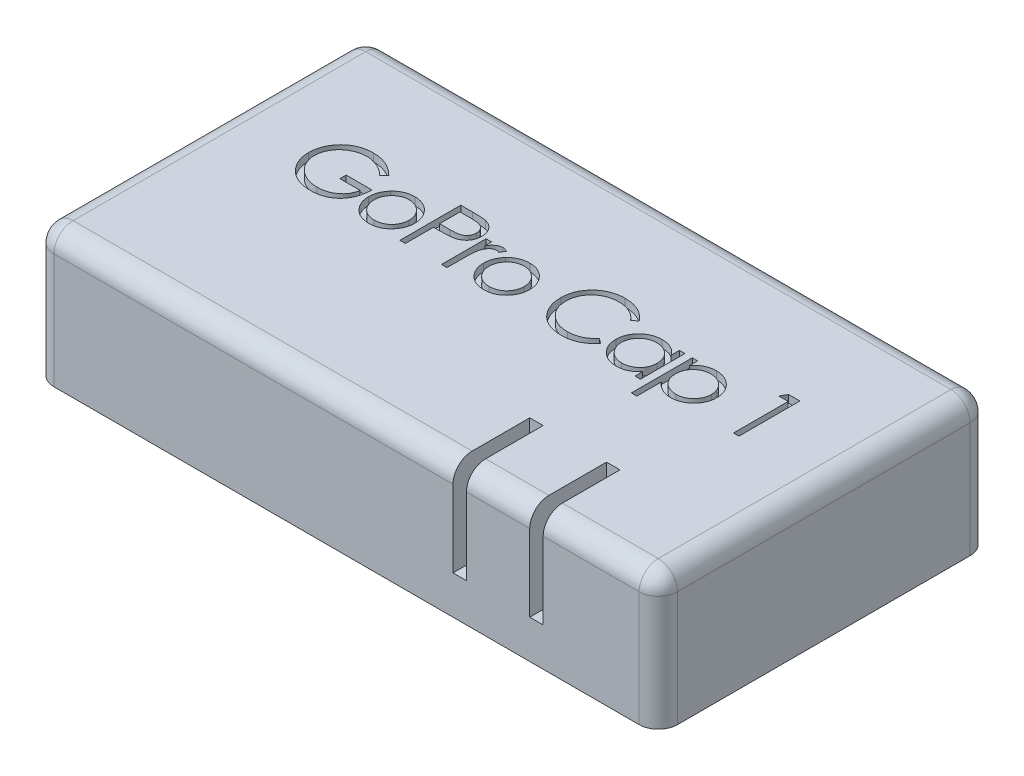
from build123d import *

# Parameters (mm, degrees)
SKETCH1_W           = 32.5
SKETCH1_H           = 17.25
BOSS_EXTRUDE1_DEPTH = 7
SKETCH2_W           = 28.5
SKETCH2_H           = 13.25
CUT_EXTRUDE1_DEPTH  = 5
FILLET1_R           = 1
FILLET2_R           = 1
SKETCH3_W           = 0.7
SKETCH3_H           = 2
CUT_EXTRUDE2_DEPTH  = 20.064446622
CUT_EXTRUDE3_DEPTH  = 0.4
SKETCH6_W           = 0.7
SKETCH6_H           = 4
CUT_EXTRUDE6_DEPTH  = 5


with BuildPart() as part:
    # Sketch1 → Boss-Extrude1 (new body)
    with BuildSketch(Plane(origin=(0, 0, 0), x_dir=(1, 0, 0), z_dir=(0, 1, 0))):
        Rectangle(SKETCH1_W, SKETCH1_H)
    extrude(amount=BOSS_EXTRUDE1_DEPTH)

    # Sketch2 → Cut-Extrude1 (cut)
    with BuildSketch(Plane.XZ):
        Rectangle(SKETCH2_W, SKETCH2_H)
    extrude(amount=-CUT_EXTRUDE1_DEPTH, mode=Mode.SUBTRACT)

    # Fillet1
    fillet1_edges = [part.edges().sort_by_distance(p)[0] for p in [
        (16.25, 7, 0),
        (0, 7, -8.625),
        (-16.25, 7, 0),
        (0, 7, 8.625),
    ]]
    fillet(fillet1_edges, radius=FILLET1_R)

    # Fillet2
    # the kernel refuses this fillet: 1 mm, written as the material it takes off along each edge
    with BuildSketch(Plane(origin=(-15.25, 6, 7.625), x_dir=(0, 0, 1), z_dir=(-1, 0, 0))) as fillet2_piece_1_section:
        Polygon((0, 0), (FILLET2_R, 0), (FILLET2_R, FILLET2_R), (0, FILLET2_R), align=None)
    fillet2_piece_1 = extrude(amount=FILLET2_R, mode=Mode.PRIVATE)
    fillet2_piece_1 = fillet2_piece_1 - Plane(origin=(-15.25, 6, 7.625), x_dir=(0, -0.7071067811865475, -0.7071067811865475), z_dir=(-1, 0, 0)) * Sphere(FILLET2_R, mode=Mode.PRIVATE)
    add(fillet2_piece_1, mode=Mode.SUBTRACT)
    with BuildSketch(Plane(origin=(-15.25, 6, -7.625), x_dir=(-1, 0, 0), z_dir=(0, 0, -1))) as fillet2_piece_2_section:
        Polygon((0, 0), (FILLET2_R, 0), (FILLET2_R, FILLET2_R), (0, FILLET2_R), align=None)
    fillet2_piece_2 = extrude(amount=FILLET2_R, mode=Mode.PRIVATE)
    fillet2_piece_2 = fillet2_piece_2 - Plane(origin=(-15.25, 6, -7.625), x_dir=(0.7071067811865475, -0.7071067811865475, 0), z_dir=(0, 0, -1)) * Sphere(FILLET2_R, mode=Mode.PRIVATE)
    add(fillet2_piece_2, mode=Mode.SUBTRACT)
    with BuildSketch(Plane(origin=(15.25, 6, 7.625), x_dir=(0, 0, 1), z_dir=(1, 0, 0))) as fillet2_piece_3_section:
        Polygon((0, 0), (FILLET2_R, 0), (FILLET2_R, -FILLET2_R), (0, -FILLET2_R), align=None)
    fillet2_piece_3 = extrude(amount=FILLET2_R, mode=Mode.PRIVATE)
    fillet2_piece_3 = fillet2_piece_3 - Plane(origin=(15.25, 6, 7.625), x_dir=(0, -0.7071067811865475, -0.7071067811865475), z_dir=(1, 0, 0)) * Sphere(FILLET2_R, mode=Mode.PRIVATE)
    add(fillet2_piece_3, mode=Mode.SUBTRACT)
    with BuildSketch(Plane(origin=(15.25, 6, -7.625), x_dir=(1, 0, 0), z_dir=(0, 0, -1))) as fillet2_piece_4_section:
        Polygon((0, 0), (FILLET2_R, 0), (FILLET2_R, -FILLET2_R), (0, -FILLET2_R), align=None)
    fillet2_piece_4 = extrude(amount=FILLET2_R, mode=Mode.PRIVATE)
    fillet2_piece_4 = fillet2_piece_4 - Plane(origin=(15.25, 6, -7.625), x_dir=(-0.7071067811865475, -0.7071067811865475, 0), z_dir=(0, 0, -1)) * Sphere(FILLET2_R, mode=Mode.PRIVATE)
    add(fillet2_piece_4, mode=Mode.SUBTRACT)
    with BuildSketch(Plane(origin=(16.25, -2.5, -8.625), x_dir=(-1, 0, 0), z_dir=(0, 1, 0)), Plane(origin=(16.25, -2.5, 8.625), x_dir=(0, 0, -1), z_dir=(0, 1, 0))) as fillet2_piece_5:
        with BuildLine():
            CenterArc((FILLET2_R, FILLET2_R), FILLET2_R, 180, 90)
            Line((0, FILLET2_R), (0, 0))
            Line((0, 0), (FILLET2_R, 0))
        make_face()
    extrude(amount=8.5, mode=Mode.SUBTRACT)
    with BuildSketch(Plane(origin=(-16.25, -2.5, -8.625), x_dir=(1, 0, 0), z_dir=(0, 1, 0)), Plane(origin=(-16.25, -2.5, 8.625), x_dir=(0, 0, -1), z_dir=(0, 1, 0))) as fillet2_piece_6:
        with BuildLine():
            CenterArc((FILLET2_R, -FILLET2_R), FILLET2_R, 90, 90)
            Line((0, -FILLET2_R), (0, 0))
            Line((0, 0), (FILLET2_R, 0))
        make_face()
    extrude(amount=8.5, mode=Mode.SUBTRACT)

    # Sketch3 → Cut-Extrude2 (cut, through all)
    with BuildSketch(Plane.XZ.offset(-5)):
        with Locations((9.9, 5.625)):
            Rectangle(SKETCH3_W, SKETCH3_H)
        with Locations((5.9, 5.625)):
            Rectangle(SKETCH3_W, SKETCH3_H)
    extrude(amount=-CUT_EXTRUDE2_DEPTH, mode=Mode.SUBTRACT)

    # Sketch4 → Cut-Extrude3 (cut)
    # profile 1 of 9: a face of its own
    with BuildSketch(Plane(origin=(0, 7, 0), x_dir=(1, 0, 0), z_dir=(0, 1, 0))):
        with BuildLine():
            Line((-9.051693105, 2.633112981), (-9.295923874, 2.401602564))
            add(Edge.make_bspline(
                [(-9.295923874, 2.401602564), (-9.340118865, 2.443177704), (-9.427454993, 2.525336601), (-9.569840356, 2.631935861), (-9.718397367, 2.723254395), (-9.872350846, 2.797555052), (-10.027888249, 2.856839342), (-10.182945067, 2.899047012), (-10.335930811, 2.925964242), (-10.437682502, 2.92918312), (-10.487820909, 2.930769231)],
                knots=[0, 0, 0, 0, 1.08915593, 2.152340314, 3.188132944, 4.216796309, 5.218260357, 6.173443236, 7.099959455, 8, 8, 8, 8], degree=3))
            add(Edge.make_bspline(
                [(-10.487820909, 2.930769231), (-10.518586387, 2.930394031), (-10.580037551, 2.929644605), (-10.671316029, 2.920079495), (-10.761637192, 2.906322797), (-10.850830539, 2.88641838), (-10.939069492, 2.86119159), (-11.026047159, 2.829636205), (-11.111925788, 2.792846805), (-11.195896447, 2.750335847), (-11.277303904, 2.703636272), (-11.354190462, 2.651885096), (-11.427046188, 2.596740979), (-11.494501716, 2.536823305), (-11.556945064, 2.47267482), (-11.615862516, 2.405488821), (-11.66918192, 2.33342973), (-11.717343191, 2.257823341), (-11.760306945, 2.179997569), (-11.798233366, 2.1007015), (-11.830071439, 2.020198146), (-11.855262302, 1.93838649), (-11.876045538, 1.855899455), (-11.890666511, 1.772165887), (-11.898909466, 1.687096129), (-11.900335295, 1.630130045), (-11.901052079, 1.601492388)],
                knots=[0, 0, 0, 0, 1.02818874, 2.053710826, 3.065248034, 4.081641283, 5.106893873, 6.131558223, 7.173050175, 8.228653731, 9.27666206, 10.308777013, 11.325269123, 12.329503258, 13.32196095, 14.316845687, 15.314881793, 16.315733098, 17.311955233, 18.285320748, 19.252783886, 20.203351036, 21.145449891, 22.095197417, 23.042428769, 24, 24, 24, 24], degree=3))
            add(Edge.make_bspline(
                [(-11.901052079, 1.601492388), (-11.900366535, 1.572218146), (-11.898997318, 1.513749602), (-11.890234028, 1.426487836), (-11.873970553, 1.340522078), (-11.852228417, 1.255569843), (-11.825031534, 1.17148564), (-11.791129187, 1.088634006), (-11.750973963, 1.007018008), (-11.704495091, 0.927373027), (-11.653526178, 0.849791427), (-11.596427812, 0.776712433), (-11.535775711, 0.707162899), (-11.469360245, 0.642687027), (-11.399311089, 0.581560207), (-11.323535381, 0.525466555), (-11.243523149, 0.473325596), (-11.159152321, 0.425794467), (-11.071338369, 0.383332438), (-10.981298314, 0.345573618), (-10.88874451, 0.314477362), (-10.794163356, 0.289133511), (-10.697667602, 0.26835967), (-10.598767438, 0.254995206), (-10.498190053, 0.245297095), (-10.430391436, 0.244588008), (-10.396234371, 0.244230769)],
                knots=[0, 0, 0, 0, 0.93586088, 1.869166235, 2.799637598, 3.729985548, 4.670839027, 5.622275134, 6.589130586, 7.576015415, 8.568469353, 9.55398029, 10.53834874, 11.515998671, 12.510579167, 13.508179873, 14.527009472, 15.561807829, 16.601455013, 17.643573243, 18.680854198, 19.719860599, 20.772568776, 21.833555941, 22.908541556, 24, 24, 24, 24], degree=3))
            add(Edge.make_bspline(
                [(-10.396234371, 0.244230769), (-10.355069727, 0.245091263), (-10.274236262, 0.246780984), (-10.155412846, 0.259934818), (-10.041291489, 0.280478695), (-9.932192861, 0.310564901), (-9.82799025, 0.348940378), (-9.728301653, 0.395200478), (-9.633911934, 0.451119539), (-9.544537341, 0.514232975), (-9.462207608, 0.584550002), (-9.387954224, 0.660427472), (-9.322961531, 0.741497075), (-9.266260839, 0.827281326), (-9.219353703, 0.918490281), (-9.180852024, 1.014676963), (-9.151339681, 1.115884634), (-9.139224811, 1.185817757), (-9.133103361, 1.221153846)],
                knots=[0, 0, 0, 0, 1.13008108, 2.219097802, 3.278683437, 4.311054135, 5.322181354, 6.324827112, 7.324222904, 8.330512327, 9.32562643, 10.293043162, 11.24128371, 12.174520618, 13.111833804, 14.052305215, 15.015860969, 16, 16, 16, 16], degree=3))
            Line((-9.133103361, 1.221153846), (-10.191436694, 1.221153846))
            Line((-10.191436694, 1.221153846), (-10.191436694, 1.546794872))
            Line((-10.191436694, 1.546794872), (-8.848167464, 1.546794872))
            add(Edge.make_bspline(
                [(-8.848167464, 1.546794872), (-8.849714912, 1.486100221), (-8.852743547, 1.367309826), (-8.873987849, 1.194072509), (-8.908292828, 1.030449616), (-8.955156111, 0.876268829), (-9.015821544, 0.731748642), (-9.089638052, 0.59674232), (-9.177787048, 0.472122045), (-9.277128662, 0.356870449), (-9.388616481, 0.254064664), (-9.509238015, 0.163707849), (-9.639192551, 0.087596191), (-9.778357162, 0.025674018), (-9.926276269, -0.022653106), (-10.083292157, -0.056917322), (-10.249191894, -0.077445931), (-10.362890166, -0.080068825), (-10.421039058, -0.081410256)],
                knots=[0, 0, 0, 0, 1.140356446, 2.231883559, 3.274166699, 4.278491846, 5.25512956, 6.21435461, 7.1637429, 8.11826594, 9.068280886, 10.0076534, 10.945064095, 11.891975133, 12.864533718, 13.863980011, 14.907571808, 16, 16, 16, 16], degree=3))
            add(Edge.make_bspline(
                [(-10.421039058, -0.081410256), (-10.456880395, -0.080893982), (-10.527571063, -0.079875723), (-10.631974977, -0.072639129), (-10.733500247, -0.061498892), (-10.832132084, -0.044675816), (-10.928233294, -0.02407038), (-11.021323917, 0.00231543), (-11.111758569, 0.03285775), (-11.199677028, 0.067597396), (-11.284281295, 0.107848828), (-11.365948207, 0.152579715), (-11.445129192, 0.201559407), (-11.521284892, 0.25563496), (-11.594812106, 0.314401906), (-11.66523673, 0.377978032), (-11.732953019, 0.446168976), (-11.775371439, 0.494591364), (-11.796745188, 0.518990385)],
                knots=[0, 0, 0, 0, 1.107784379, 2.184907829, 3.233506516, 4.263428166, 5.276301166, 6.270063455, 7.25232949, 8.225834625, 9.190232166, 10.146266622, 11.1027726, 12.066435141, 13.031522626, 14.010570082, 14.99756817, 16, 16, 16, 16], degree=3))
            add(Edge.make_bspline(
                [(-11.796745188, 0.518990385), (-11.827756712, 0.557698763), (-11.889265001, 0.634473), (-11.968438757, 0.757481521), (-12.035931458, 0.884846065), (-12.090693697, 1.016921192), (-12.133454675, 1.153583364), (-12.164121776, 1.29465795), (-12.182089817, 1.440326615), (-12.184678383, 1.538901533), (-12.185987976, 1.588772035)],
                knots=[0, 0, 0, 0, 1.023165419, 2.029347347, 3.013907458, 3.994755782, 4.975994455, 5.96558838, 6.970761222, 8, 8, 8, 8], degree=3))
            add(Edge.make_bspline(
                [(-12.185987976, 1.588772035), (-12.18550516, 1.626115707), (-12.184545665, 1.700328436), (-12.172911089, 1.810507565), (-12.156218374, 1.918730336), (-12.131682832, 2.024908283), (-12.100752649, 2.12911232), (-12.062150558, 2.23139083), (-12.01720626, 2.331804171), (-11.964967988, 2.42966118), (-11.906834228, 2.523663326), (-11.843742243, 2.61343219), (-11.77479612, 2.697332985), (-11.701121787, 2.776428266), (-11.621840232, 2.849724363), (-11.537694183, 2.917899877), (-11.448618794, 2.98104626), (-11.35433383, 3.038168896), (-11.256246574, 3.08948018), (-11.154592144, 3.134464679), (-11.049401572, 3.171642401), (-10.941462932, 3.203187187), (-10.829959199, 3.226514493), (-10.715699533, 3.243431569), (-10.59808836, 3.255007256), (-10.518589962, 3.255938217), (-10.478280645, 3.256410256)],
                knots=[0, 0, 0, 0, 1.008945113, 2.00506715, 2.99143336, 3.967273523, 4.948097931, 5.927297278, 6.919902385, 7.919676788, 8.923139349, 9.905703106, 10.883022732, 11.856032218, 12.825136022, 13.798837087, 14.781400844, 15.773989409, 16.776158564, 17.77167057, 18.775803737, 19.789618931, 20.80898985, 21.851988756, 22.910860228, 24, 24, 24, 24], degree=3))
            add(Edge.make_bspline(
                [(-10.478280645, 3.256410256), (-10.445407381, 3.255884575), (-10.380223562, 3.254842209), (-10.283226647, 3.247617136), (-10.187728984, 3.236165472), (-10.093588973, 3.220538316), (-10.001127198, 3.199253397), (-9.910080258, 3.173782381), (-9.820316172, 3.144126228), (-9.73211626, 3.108757774), (-9.644887475, 3.068613415), (-9.558144805, 3.023425524), (-9.472184632, 2.972421413), (-9.386857885, 2.915449634), (-9.301626499, 2.853488677), (-9.217838574, 2.784766415), (-9.133471617, 2.711992915), (-9.079222828, 2.659666934), (-9.051693105, 2.633112981)],
                knots=[0, 0, 0, 0, 0.985871117, 1.954866573, 2.915460327, 3.869826059, 4.81536089, 5.759505086, 6.70452669, 7.649098992, 8.607881297, 9.583363685, 10.581137262, 11.603961102, 12.659522466, 13.73993555, 14.853081303, 16, 16, 16, 16], degree=3))
        make_face()
    # profile 2 of 9: a face of its own
    with BuildSketch(Plane(origin=(0, 7, 0), x_dir=(1, 0, 0), z_dir=(0, 1, 0))):
        with BuildLine():
            add(Edge.make_bspline(
                [(-7.426286454, 2.360897436), (-7.382751514, 2.359970435), (-7.297390135, 2.358152812), (-7.172378696, 2.338726379), (-7.053048465, 2.309019841), (-6.938942419, 2.267952067), (-6.831521923, 2.212904869), (-6.729222294, 2.147219298), (-6.632324008, 2.069402231), (-6.574245974, 2.009205983), (-6.544766021, 1.978650841)],
                knots=[0, 0, 0, 0, 1.054011418, 2.066658804, 3.057071809, 4.030435133, 4.997543892, 5.974964718, 6.972108034, 8, 8, 8, 8], degree=3))
            add(Edge.make_bspline(
                [(-6.544766021, 1.978650841), (-6.519382392, 1.949428154), (-6.469106375, 1.89154832), (-6.404639616, 1.797699299), (-6.349102915, 1.700507922), (-6.3045958, 1.598683562), (-6.269502957, 1.49311511), (-6.244587647, 1.383439714), (-6.229767713, 1.269899585), (-6.227769308, 1.19278896), (-6.226757207, 1.153735978)],
                knots=[0, 0, 0, 0, 1.025258237, 2.030674902, 3.01204498, 3.988269485, 4.97094183, 5.956517959, 6.965070386, 8, 8, 8, 8], degree=3))
            add(Edge.make_bspline(
                [(-6.226757207, 1.153735978), (-6.22764742, 1.11445664), (-6.229406523, 1.036838836), (-6.246046804, 0.922521268), (-6.271928574, 0.811673108), (-6.308968885, 0.704758435), (-6.35646517, 0.601450442), (-6.41442315, 0.502200351), (-6.483249546, 0.406812344), (-6.561267457, 0.316096391), (-6.647493088, 0.232488468), (-6.741034165, 0.159619252), (-6.840052467, 0.097188297), (-6.945864652, 0.046899549), (-7.057504444, 0.007248606), (-7.175212641, -0.020600694), (-7.298806383, -0.037438793), (-7.383195363, -0.039601034), (-7.426286454, -0.040705128)],
                knots=[0, 0, 0, 0, 0.998656419, 1.973391657, 2.932242238, 3.890759089, 4.846373663, 5.82037756, 6.809684879, 7.83454468, 8.860553229, 9.859544525, 10.845671541, 11.83227036, 12.833544569, 13.85385346, 14.904124723, 16, 16, 16, 16], degree=3))
            add(Edge.make_bspline(
                [(-7.426286454, -0.040705128), (-7.469588664, -0.039597329), (-7.554398229, -0.037427648), (-7.678428227, -0.020666113), (-7.796347382, 0.007235772), (-7.908133325, 0.047029854), (-8.014400436, 0.097189905), (-8.113992472, 0.159430509), (-8.207609539, 0.232510078), (-8.29385341, 0.316090535), (-8.371866431, 0.406813853), (-8.440694088, 0.502199959), (-8.498651741, 0.601450544), (-8.546148112, 0.704758408), (-8.583188399, 0.811673115), (-8.609070176, 0.922521266), (-8.625710455, 1.036838836), (-8.627469558, 1.11445664), (-8.628359771, 1.153735978)],
                knots=[0, 0, 0, 0, 1.099876186, 2.154163076, 3.173186993, 4.173200201, 5.163417411, 6.152872554, 7.150605724, 8.17532212, 9.198891216, 10.186952605, 11.159729845, 12.11414092, 13.071450619, 14.029093627, 15.002601286, 16, 16, 16, 16], degree=3))
            add(Edge.make_bspline(
                [(-8.628359771, 1.153735978), (-8.627340768, 1.192576701), (-8.625323318, 1.269474659), (-8.610518284, 1.38280135), (-8.585700165, 1.492291124), (-8.550565256, 1.597452092), (-8.505647904, 1.698830237), (-8.450891593, 1.796261763), (-8.385767233, 1.88968641), (-8.335691177, 1.94749144), (-8.310350957, 1.976742788)],
                knots=[0, 0, 0, 0, 1.031353054, 2.041901799, 3.029428768, 4.008703097, 4.981709435, 5.96992636, 6.972712378, 8, 8, 8, 8], degree=3))
            add(Edge.make_bspline(
                [(-8.310350957, 1.976742788), (-8.28091545, 2.007562912), (-8.223025345, 2.068176108), (-8.125644713, 2.145766326), (-8.023596747, 2.212818764), (-7.914989135, 2.266772189), (-7.800976828, 2.309261415), (-7.681035087, 2.33880299), (-7.555599441, 2.358082819), (-7.469820356, 2.35994988), (-7.426286454, 2.360897436)],
                knots=[0, 0, 0, 0, 1.027980169, 2.021703884, 2.998553061, 3.971491411, 4.943284454, 5.930300938, 6.949603206, 8, 8, 8, 8], degree=3))
        make_face()
        with BuildLine():
            add(Edge.make_bspline(
                [(-7.427558489, 2.075961538), (-7.458344751, 2.075086516), (-7.519122532, 2.07335906), (-7.608584584, 2.060220089), (-7.694708866, 2.039403425), (-7.777658775, 2.009826888), (-7.857154581, 1.971637172), (-7.933272396, 1.924730303), (-8.00623611, 1.869727549), (-8.07461841, 1.806714983), (-8.13737665, 1.737881895), (-8.192238815, 1.664540884), (-8.238888733, 1.587881555), (-8.277750877, 1.507824192), (-8.306695255, 1.423557503), (-8.327716497, 1.336035787), (-8.340843072, 1.245080731), (-8.342554287, 1.18324895), (-8.343423874, 1.151827925)],
                knots=[0, 0, 0, 0, 1.021534396, 2.016698045, 2.994645724, 3.958388632, 4.93408049, 5.916473867, 6.921342795, 7.962252576, 8.998418191, 10.008913653, 10.997312074, 11.973003931, 12.956656626, 13.948281152, 14.957379055, 16, 16, 16, 16], degree=3))
            add(Edge.make_bspline(
                [(-8.343423874, 1.151827925), (-8.341966255, 1.111231443), (-8.339073155, 1.030655018), (-8.315546191, 0.911990642), (-8.276188637, 0.798069962), (-8.223041604, 0.689560812), (-8.156451677, 0.589165246), (-8.077995553, 0.499656113), (-7.988515253, 0.422380413), (-7.889077428, 0.358262789), (-7.781713154, 0.307317867), (-7.668087777, 0.271214511), (-7.549578004, 0.24774519), (-7.468587627, 0.245412495), (-7.427558489, 0.244230769)],
                knots=[0, 0, 0, 0, 1.016792936, 2.018143844, 3.017858371, 4.030088057, 5.03801393, 6.028138512, 7.003788237, 7.991172063, 8.984598303, 9.972568034, 10.972917682, 12, 12, 12, 12], degree=3))
            add(Edge.make_bspline(
                [(-7.427558489, 0.244230769), (-7.386531712, 0.245419381), (-7.305545993, 0.247765666), (-7.187200882, 0.27109631), (-7.073886065, 0.307476059), (-6.966633306, 0.358205493), (-6.867240744, 0.422623898), (-6.777116899, 0.499219754), (-6.699330659, 0.589402319), (-6.632806603, 0.689693792), (-6.5787892, 0.79790174), (-6.539615867, 0.912011668), (-6.516032343, 1.030649663), (-6.513146877, 1.111229649), (-6.511693105, 1.151827925)],
                knots=[0, 0, 0, 0, 1.02726834, 2.027799167, 3.010890988, 4.004497153, 4.992059811, 5.971914811, 6.958719428, 7.966827853, 8.981595046, 9.981490638, 10.983022906, 12, 12, 12, 12], degree=3))
            add(Edge.make_bspline(
                [(-6.511693105, 1.151827925), (-6.512562392, 1.183249138), (-6.514273018, 1.245081288), (-6.527403879, 1.336033657), (-6.548409261, 1.423565319), (-6.577412085, 1.507795351), (-6.616105369, 1.588088837), (-6.663654889, 1.664315804), (-6.718293033, 1.738135956), (-6.781808564, 1.806492473), (-6.850119486, 1.869752114), (-6.92311277, 1.924751631), (-6.999117715, 1.971431021), (-7.078382572, 2.01015354), (-7.161343116, 2.039134341), (-7.247346726, 2.060340285), (-7.336427075, 2.073303535), (-7.396987064, 2.075069871), (-7.427558489, 2.075961538)],
                knots=[0, 0, 0, 0, 1.042956736, 2.052379634, 3.044323526, 4.02829302, 5.004299113, 5.996692471, 7.007513377, 8.048758398, 9.090003419, 10.095195979, 11.07790575, 12.047570684, 13.018257071, 13.989683339, 14.985167495, 16, 16, 16, 16], degree=3))
        make_face(mode=Mode.SUBTRACT)
    # profile 3 of 9: a face of its own
    with BuildSketch(Plane(origin=(0, 7, 0), x_dir=(1, 0, 0), z_dir=(0, 1, 0))):
        with BuildLine():
            Line((-5.844129002, 3.175), (-5.221467744, 3.175))
            add(Edge.make_bspline(
                [(-5.221467744, 3.175), (-5.178640708, 3.174952923), (-5.096582204, 3.17486272), (-4.978912118, 3.172127915), (-4.872041862, 3.16847513), (-4.776201873, 3.163411556), (-4.69109727, 3.157427506), (-4.617113148, 3.149034585), (-4.553667979, 3.140271317), (-4.515652843, 3.131361898), (-4.498315701, 3.127298678)],
                knots=[0, 0, 0, 0, 1.415646017, 2.712440637, 3.8905458, 4.950247383, 5.884950622, 6.709939814, 7.411656543, 8, 8, 8, 8], degree=3))
            add(Edge.make_bspline(
                [(-4.498315701, 3.127298678), (-4.476368709, 3.121291623), (-4.43299188, 3.109419063), (-4.370488791, 3.085639471), (-4.311022088, 3.057443507), (-4.254387746, 3.025308933), (-4.201281714, 2.987857028), (-4.150911662, 2.946605961), (-4.103722109, 2.900603324), (-4.059978417, 2.850365081), (-4.01980578, 2.796734605), (-3.98521671, 2.738911296), (-3.956254154, 2.677868471), (-3.931413615, 2.613648589), (-3.913535231, 2.545712367), (-3.900066972, 2.474531849), (-3.891518396, 2.400114666), (-3.890699643, 2.349260357), (-3.890282848, 2.323372396)],
                knots=[0, 0, 0, 0, 0.999701418, 1.975846123, 2.934577507, 3.890451536, 4.834027766, 5.787354733, 6.749476667, 7.726910423, 8.712836071, 9.690891519, 10.682875813, 11.679750201, 12.712814741, 13.765529915, 14.8625177, 16, 16, 16, 16], degree=3))
            add(Edge.make_bspline(
                [(-3.890282848, 2.323372396), (-3.890665141, 2.297266841), (-3.891413122, 2.24618956), (-3.900390466, 2.171465674), (-3.912482854, 2.100056849), (-3.931076609, 2.032121418), (-3.95542947, 1.968062827), (-3.98399726, 1.906902138), (-4.018453749, 1.849679864), (-4.058045844, 1.796188264), (-4.102089076, 1.74637713), (-4.150397099, 1.700607423), (-4.202774885, 1.659147059), (-4.259055977, 1.62190309), (-4.319789054, 1.589739179), (-4.384053008, 1.560930767), (-4.452406418, 1.536736305), (-4.499707127, 1.524009035), (-4.523756406, 1.517538061)],
                knots=[0, 0, 0, 0, 1.121902311, 2.195077645, 3.232258892, 4.234102512, 5.217864754, 6.176164875, 7.132989551, 8.084763148, 9.034132444, 9.988522005, 10.94243251, 11.903244335, 12.886203696, 13.894208494, 14.929344452, 16, 16, 16, 16], degree=3))
            add(Edge.make_bspline(
                [(-4.523756406, 1.517538061), (-4.54364763, 1.513308071), (-4.587240405, 1.504037802), (-4.65903416, 1.493688702), (-4.742623189, 1.484855307), (-4.8378934, 1.478232132), (-4.944759278, 1.472562155), (-5.063278633, 1.468055384), (-5.193684117, 1.465579017), (-5.28464446, 1.465451298), (-5.332134811, 1.465384615)],
                knots=[0, 0, 0, 0, 0.601384939, 1.31797006, 2.144135048, 3.087295005, 4.142315834, 5.309527816, 6.595305764, 8, 8, 8, 8], degree=3))
            Line((-5.332134811, 1.465384615), (-5.559193105, 1.465384615))
            Line((-5.559193105, 1.465384615), (-5.559193105, 0))
            Line((-5.559193105, 0), (-5.844129002, 0))
            Line((-5.844129002, 0), (-5.844129002, 3.175))
        make_face()
        with BuildLine():
            Line((-5.559193105, 2.849358974), (-5.559193105, 1.791025641))
            Line((-5.559193105, 1.791025641), (-5.003313698, 1.784029447))
            add(Edge.make_bspline(
                [(-5.003313698, 1.784029447), (-4.976172051, 1.784015419), (-4.923775661, 1.783988339), (-4.848087087, 1.787603506), (-4.777865805, 1.791776847), (-4.713327511, 1.797887291), (-4.654443114, 1.806524432), (-4.601114427, 1.815243652), (-4.553754963, 1.827857802), (-4.498329258, 1.8448423), (-4.436567936, 1.873809745), (-4.369378089, 1.915855716), (-4.312436199, 1.969450359), (-4.263161745, 2.029709891), (-4.224058555, 2.096746959), (-4.195432762, 2.16847378), (-4.178613284, 2.244154758), (-4.176357951, 2.295941855), (-4.175218746, 2.322100361)],
                knots=[0, 0, 0, 0, 1.160613943, 2.240541288, 3.23993089, 4.169200891, 5.011653406, 5.7853311, 6.478053781, 7.106038997, 8.262395093, 9.384106736, 10.481365981, 11.59014053, 12.70357646, 13.786202915, 14.881775077, 16, 16, 16, 16], degree=3))
            add(Edge.make_bspline(
                [(-4.175218746, 2.322100361), (-4.176364146, 2.347626012), (-4.178641061, 2.398367848), (-4.195564594, 2.472734295), (-4.224002901, 2.543705256), (-4.26342424, 2.609902269), (-4.311267979, 2.669944969), (-4.36687524, 2.722103078), (-4.430115127, 2.764032765), (-4.488941737, 2.791095813), (-4.541194242, 2.80761967), (-4.586580377, 2.819181061), (-4.637825488, 2.82841179), (-4.69494626, 2.835886196), (-4.757499959, 2.842284693), (-4.826024002, 2.846626258), (-4.900258807, 2.849167579), (-4.95179411, 2.849293631), (-4.97850901, 2.849358974)],
                knots=[0, 0, 0, 0, 1.120700087, 2.227813068, 3.331159281, 4.466773991, 5.599788987, 6.693661531, 7.80175334, 8.91857717, 9.525282508, 10.207424825, 10.974604443, 11.810962634, 12.737642355, 13.736264703, 14.826523623, 16, 16, 16, 16], degree=3))
            Line((-4.97850901, 2.849358974), (-5.559193105, 2.849358974))
        make_face(mode=Mode.SUBTRACT)
    # profile 4 of 9: a face of its own
    with BuildSketch(Plane(origin=(0, 7, 0), x_dir=(1, 0, 0), z_dir=(0, 1, 0))):
        with BuildLine():
            Line((-3.670475156, 2.320192308), (-3.385539259, 2.320192308))
            Line((-3.385539259, 2.320192308), (-3.385539259, 1.978650841))
            add(Edge.make_bspline(
                [(-3.385539259, 1.978650841), (-3.364503742, 2.010451486), (-3.324273479, 2.071269971), (-3.257405322, 2.151705694), (-3.188913014, 2.218303629), (-3.118468666, 2.271374678), (-3.045554246, 2.311119436), (-2.971770012, 2.340232403), (-2.895955121, 2.357447539), (-2.845008233, 2.35974593), (-2.819483569, 2.360897436)],
                knots=[0, 0, 0, 0, 1.2804753, 2.448899062, 3.506932113, 4.484331642, 5.4025378, 6.288909075, 7.142734305, 8, 8, 8, 8], degree=3))
            add(Edge.make_bspline(
                [(-2.819483569, 2.360897436), (-2.799683973, 2.359817458), (-2.758945017, 2.357595334), (-2.697275097, 2.341982657), (-2.63373568, 2.317056165), (-2.592785085, 2.293615392), (-2.571436694, 2.281395232)],
                knots=[0, 0, 0, 0, 0.901110191, 1.854092781, 2.881294221, 4, 4, 4, 4], degree=3))
            Line((-2.571436694, 2.281395232), (-2.727897031, 2.034620393))
            add(Edge.make_bspline(
                [(-2.727897031, 2.034620393), (-2.741603072, 2.040734777), (-2.76761976, 2.052341049), (-2.805678546, 2.066077015), (-2.840768044, 2.074165024), (-2.863123272, 2.075390318), (-2.873545068, 2.075961538)],
                knots=[0, 0, 0, 0, 1.180555205, 2.24091978, 3.179933427, 4, 4, 4, 4], degree=3))
            add(Edge.make_bspline(
                [(-2.873545068, 2.075961538), (-2.896410269, 2.074437505), (-2.943048651, 2.071328917), (-3.011523876, 2.04689157), (-3.077969555, 2.007407959), (-3.130739563, 1.963619165), (-3.171599321, 1.921393663), (-3.200755097, 1.884519755), (-3.22750016, 1.843173425), (-3.253054574, 1.798061498), (-3.27633757, 1.748413709), (-3.298067877, 1.694726079), (-3.31771556, 1.636936427), (-3.328918996, 1.596675141), (-3.334657848, 1.576051683)],
                knots=[0, 0, 0, 0, 1.125678352, 2.296057538, 3.5422874, 4.923748041, 5.663163013, 6.437101912, 7.23742474, 8.08941207, 8.991984279, 9.93940061, 10.944477711, 12, 12, 12, 12], degree=3))
            add(Edge.make_bspline(
                [(-3.334657848, 1.576051683), (-3.338950805, 1.55765739), (-3.348459378, 1.516915428), (-3.357704559, 1.448563552), (-3.36683905, 1.367806376), (-3.373276697, 1.274419109), (-3.379243921, 1.168634964), (-3.382609496, 1.050292785), (-3.385424487, 0.919271102), (-3.385499841, 0.827672938), (-3.385539259, 0.779757612)],
                knots=[0, 0, 0, 0, 0.566838948, 1.255505196, 2.06880316, 3.007127437, 4.065329342, 5.249902469, 6.561414163, 8, 8, 8, 8], degree=3))
            Line((-3.385539259, 0.779757612), (-3.385539259, 0))
            Line((-3.385539259, 0), (-3.670475156, 0))
            Line((-3.670475156, 0), (-3.670475156, 2.320192308))
        make_face()
    # profile 5 of 9: a face of its own
    with BuildSketch(Plane(origin=(0, 7, 0), x_dir=(1, 0, 0), z_dir=(0, 1, 0))):
        with BuildLine():
            add(Edge.make_bspline(
                [(-1.434491582, 2.360897436), (-1.390956642, 2.359970435), (-1.305595263, 2.358152812), (-1.180583824, 2.338726379), (-1.061253593, 2.309019841), (-0.947147548, 2.267952067), (-0.839727051, 2.212904869), (-0.737427422, 2.147219298), (-0.640529136, 2.069402231), (-0.582451102, 2.009205983), (-0.55297115, 1.978650841)],
                knots=[0, 0, 0, 0, 1.054011418, 2.066658804, 3.057071809, 4.030435133, 4.997543892, 5.974964718, 6.972108034, 8, 8, 8, 8], degree=3))
            add(Edge.make_bspline(
                [(-0.55297115, 1.978650841), (-0.52758752, 1.949428154), (-0.477311503, 1.89154832), (-0.412844744, 1.797699299), (-0.357308043, 1.700507922), (-0.312800929, 1.598683562), (-0.277708086, 1.49311511), (-0.252792776, 1.383439714), (-0.237972842, 1.269899585), (-0.235974436, 1.19278896), (-0.234962335, 1.153735978)],
                knots=[0, 0, 0, 0, 1.025258237, 2.030674902, 3.01204498, 3.988269485, 4.97094183, 5.956517959, 6.965070386, 8, 8, 8, 8], degree=3))
            add(Edge.make_bspline(
                [(-0.234962335, 1.153735978), (-0.235852549, 1.11445664), (-0.237611651, 1.036838836), (-0.254251932, 0.922521268), (-0.280133703, 0.811673108), (-0.317174013, 0.704758435), (-0.364670298, 0.601450442), (-0.422628279, 0.502200351), (-0.491454674, 0.406812344), (-0.569472586, 0.316096391), (-0.655698216, 0.232488468), (-0.749239293, 0.159619252), (-0.848257595, 0.097188297), (-0.95406978, 0.046899549), (-1.065709572, 0.007248606), (-1.183417769, -0.020600694), (-1.307011512, -0.037438793), (-1.391400491, -0.039601034), (-1.434491582, -0.040705128)],
                knots=[0, 0, 0, 0, 0.998656419, 1.973391657, 2.932242238, 3.890759089, 4.846373663, 5.82037756, 6.809684879, 7.83454468, 8.860553229, 9.859544525, 10.845671541, 11.83227036, 12.833544569, 13.85385346, 14.904124723, 16, 16, 16, 16], degree=3))
            add(Edge.make_bspline(
                [(-1.434491582, -0.040705128), (-1.477793792, -0.039597329), (-1.562603358, -0.037427648), (-1.686633356, -0.020666113), (-1.80455251, 0.007235772), (-1.916338453, 0.047029854), (-2.022605564, 0.097189905), (-2.122197601, 0.159430509), (-2.215814667, 0.232510078), (-2.302058538, 0.316090535), (-2.380071559, 0.406813853), (-2.448899216, 0.502199959), (-2.506856869, 0.601450544), (-2.55435324, 0.704758408), (-2.591393528, 0.811673115), (-2.617275304, 0.922521266), (-2.633915583, 1.036838836), (-2.635674686, 1.11445664), (-2.6365649, 1.153735978)],
                knots=[0, 0, 0, 0, 1.099876186, 2.154163076, 3.173186993, 4.173200201, 5.163417411, 6.152872554, 7.150605724, 8.17532212, 9.198891216, 10.186952605, 11.159729845, 12.11414092, 13.071450619, 14.029093627, 15.002601286, 16, 16, 16, 16], degree=3))
            add(Edge.make_bspline(
                [(-2.6365649, 1.153735978), (-2.635545897, 1.192576701), (-2.633528446, 1.269474659), (-2.618723413, 1.38280135), (-2.593905293, 1.492291124), (-2.558770384, 1.597452092), (-2.513853032, 1.698830237), (-2.459096721, 1.796261763), (-2.393972361, 1.88968641), (-2.343896305, 1.94749144), (-2.318556085, 1.976742788)],
                knots=[0, 0, 0, 0, 1.031353054, 2.041901799, 3.029428768, 4.008703097, 4.981709435, 5.96992636, 6.972712378, 8, 8, 8, 8], degree=3))
            add(Edge.make_bspline(
                [(-2.318556085, 1.976742788), (-2.289120578, 2.007562912), (-2.231230473, 2.068176108), (-2.133849841, 2.145766326), (-2.031801875, 2.212818764), (-1.923194263, 2.266772189), (-1.809181956, 2.309261415), (-1.689240215, 2.33880299), (-1.563804569, 2.358082819), (-1.478025484, 2.35994988), (-1.434491582, 2.360897436)],
                knots=[0, 0, 0, 0, 1.027980169, 2.021703884, 2.998553061, 3.971491411, 4.943284454, 5.930300938, 6.949603206, 8, 8, 8, 8], degree=3))
        make_face()
        with BuildLine():
            add(Edge.make_bspline(
                [(-1.435763617, 2.075961538), (-1.466549879, 2.075086516), (-1.52732766, 2.07335906), (-1.616789712, 2.060220089), (-1.702913995, 2.039403425), (-1.785863903, 2.009826888), (-1.86535971, 1.971637172), (-1.941477525, 1.924730303), (-2.014441238, 1.869727549), (-2.082823538, 1.806714983), (-2.145581779, 1.737881895), (-2.200443943, 1.664540884), (-2.247093861, 1.587881555), (-2.285956005, 1.507824192), (-2.314900383, 1.423557503), (-2.335921625, 1.336035787), (-2.3490482, 1.245080731), (-2.350759415, 1.18324895), (-2.351629002, 1.151827925)],
                knots=[0, 0, 0, 0, 1.021534396, 2.016698045, 2.994645724, 3.958388632, 4.93408049, 5.916473867, 6.921342795, 7.962252576, 8.998418191, 10.008913653, 10.997312074, 11.973003931, 12.956656626, 13.948281152, 14.957379055, 16, 16, 16, 16], degree=3))
            add(Edge.make_bspline(
                [(-2.351629002, 1.151827925), (-2.350171384, 1.111231443), (-2.347278283, 1.030655018), (-2.323751319, 0.911990642), (-2.284393765, 0.798069962), (-2.231246733, 0.689560812), (-2.164656806, 0.589165246), (-2.086200681, 0.499656113), (-1.996720381, 0.422380413), (-1.897282556, 0.358262789), (-1.789918282, 0.307317867), (-1.676292905, 0.271214511), (-1.557783132, 0.24774519), (-1.476792755, 0.245412495), (-1.435763617, 0.244230769)],
                knots=[0, 0, 0, 0, 1.016792936, 2.018143844, 3.017858371, 4.030088057, 5.03801393, 6.028138512, 7.003788237, 7.991172063, 8.984598303, 9.972568034, 10.972917682, 12, 12, 12, 12], degree=3))
            add(Edge.make_bspline(
                [(-1.435763617, 0.244230769), (-1.39473684, 0.245419381), (-1.313751121, 0.247765666), (-1.19540601, 0.27109631), (-1.082091193, 0.307476059), (-0.974838434, 0.358205493), (-0.875445873, 0.422623898), (-0.785322027, 0.499219754), (-0.707535787, 0.589402319), (-0.641011731, 0.689693792), (-0.586994329, 0.79790174), (-0.547820996, 0.912011668), (-0.524237471, 1.030649663), (-0.521352005, 1.111229649), (-0.519898233, 1.151827925)],
                knots=[0, 0, 0, 0, 1.02726834, 2.027799167, 3.010890988, 4.004497153, 4.992059811, 5.971914811, 6.958719428, 7.966827853, 8.981595046, 9.981490638, 10.983022906, 12, 12, 12, 12], degree=3))
            add(Edge.make_bspline(
                [(-0.519898233, 1.151827925), (-0.520767521, 1.183249138), (-0.522478146, 1.245081288), (-0.535609007, 1.336033657), (-0.556614389, 1.423565319), (-0.585617214, 1.507795351), (-0.624310498, 1.588088837), (-0.671860017, 1.664315804), (-0.726498161, 1.738135956), (-0.790013693, 1.806492473), (-0.858324614, 1.869752114), (-0.931317899, 1.924751631), (-1.007322843, 1.971431021), (-1.086587701, 2.01015354), (-1.169548244, 2.039134341), (-1.255551854, 2.060340285), (-1.344632203, 2.073303535), (-1.405192192, 2.075069871), (-1.435763617, 2.075961538)],
                knots=[0, 0, 0, 0, 1.042956736, 2.052379634, 3.044323526, 4.02829302, 5.004299113, 5.996692471, 7.007513377, 8.048758398, 9.090003419, 10.095195979, 11.07790575, 12.047570684, 13.018257071, 13.989683339, 14.985167495, 16, 16, 16, 16], degree=3))
        make_face(mode=Mode.SUBTRACT)
    # profile 6 of 9: a face of its own
    with BuildSketch(Plane(origin=(0, 7, 0), x_dir=(1, 0, 0), z_dir=(0, 1, 0))):
        with BuildLine():
            Line((4.0309351, 2.592407853), (3.78161619, 2.401602564))
            add(Edge.make_bspline(
                [(3.78161619, 2.401602564), (3.763830849, 2.422798837), (3.72849995, 2.46490561), (3.671659102, 2.524032768), (3.612421184, 2.579427684), (3.550808838, 2.631354246), (3.485713065, 2.677996598), (3.418710769, 2.721785384), (3.348681114, 2.761035404), (3.25184204, 2.808626827), (3.125161492, 2.85828941), (2.96569046, 2.899930199), (2.799219678, 2.92643798), (2.685647569, 2.929308943), (2.627880213, 2.930769231)],
                knots=[0, 0, 0, 0, 0.757959112, 1.505699292, 2.245454638, 2.979532153, 3.711538275, 4.438200793, 5.171680507, 5.909471876, 7.393775596, 8.890124382, 10.418191784, 12, 12, 12, 12], degree=3))
            add(Edge.make_bspline(
                [(2.627880213, 2.930769231), (2.596054648, 2.930402779), (2.532698891, 2.929673277), (2.438674918, 2.920049285), (2.34640665, 2.906522687), (2.255954106, 2.886451858), (2.167432422, 2.861076696), (2.080262886, 2.830755071), (1.995707556, 2.793240323), (1.912596726, 2.751776402), (1.832968442, 2.704942934), (1.757625648, 2.653858679), (1.686843135, 2.599095284), (1.620564908, 2.540447495), (1.558723212, 2.478179431), (1.501766151, 2.411627492), (1.449890815, 2.341004449), (1.402068942, 2.267241573), (1.359240248, 2.190553719), (1.323381001, 2.110657048), (1.291626354, 2.028919754), (1.266499184, 1.944418344), (1.246610515, 1.857747406), (1.232887563, 1.768674334), (1.223373022, 1.677385211), (1.222647147, 1.61550962), (1.222281254, 1.584319912)],
                knots=[0, 0, 0, 0, 1.054917814, 2.100044995, 3.131103042, 4.146048494, 5.169673617, 6.183595914, 7.203665975, 8.234915748, 9.262203917, 10.264457458, 11.251630812, 12.227803204, 13.197192746, 14.159520551, 15.12972552, 16.100847026, 17.073214652, 18.039054194, 19.002613845, 19.979014051, 20.95965708, 21.949030935, 22.966165397, 24, 24, 24, 24], degree=3))
            add(Edge.make_bspline(
                [(1.222281254, 1.584319912), (1.223425904, 1.537392215), (1.225673273, 1.445255905), (1.245674262, 1.310299709), (1.276068166, 1.181013097), (1.321620868, 1.058204241), (1.377790292, 0.940358801), (1.448765704, 0.829470699), (1.530967849, 0.723864244), (1.625559644, 0.626035284), (1.729342063, 0.536669262), (1.840691954, 0.457974091), (1.959331986, 0.392374162), (2.083952215, 0.337785982), (2.215511618, 0.295824522), (2.353773618, 0.26628421), (2.498437499, 0.247014518), (2.597288312, 0.245169672), (2.647596759, 0.244230769)],
                knots=[0, 0, 0, 0, 1.029171465, 2.020641659, 2.987623507, 3.938342917, 4.889210282, 5.84687017, 6.821220943, 7.821438502, 8.827599549, 9.822697543, 10.807740252, 11.797342354, 12.80366471, 13.83203677, 14.896651826, 16, 16, 16, 16], degree=3))
            add(Edge.make_bspline(
                [(2.647596759, 0.244230769), (2.703025627, 0.245762734), (2.812122899, 0.248778006), (2.972113894, 0.274322468), (3.125272053, 0.315740722), (3.271605613, 0.373705266), (3.410702043, 0.449057348), (3.542779013, 0.540404709), (3.667948009, 0.648616268), (3.743214815, 0.731241677), (3.78161619, 0.773397436)],
                knots=[0, 0, 0, 0, 1.028121516, 2.023589091, 2.998037872, 3.967518031, 4.937445131, 5.927275754, 6.942489185, 8, 8, 8, 8], degree=3))
            Line((3.78161619, 0.773397436), (4.0309351, 0.5845002))
            add(Edge.make_bspline(
                [(4.0309351, 0.5845002), (4.010870815, 0.558611748), (3.970838351, 0.506958846), (3.906015721, 0.434140938), (3.837728459, 0.365647992), (3.76546935, 0.302032221), (3.690069639, 0.24202067), (3.61017547, 0.187318294), (3.526837134, 0.137161564), (3.440336999, 0.091235711), (3.350766972, 0.050489351), (3.258234377, 0.01560629), (3.16313807, -0.014442717), (3.065473701, -0.039164117), (2.965038693, -0.058460028), (2.862195478, -0.071359305), (2.756722091, -0.080196613), (2.685564516, -0.081002079), (2.649504812, -0.081410256)],
                knots=[0, 0, 0, 0, 0.986787822, 1.968848986, 2.935600012, 3.899624008, 4.868462664, 5.837806735, 6.815139263, 7.798259679, 8.787526145, 9.778297419, 10.776456485, 11.791383307, 12.812564526, 13.85620153, 14.913611965, 16, 16, 16, 16], degree=3))
            add(Edge.make_bspline(
                [(2.649504812, -0.081410256), (2.615356628, -0.081172592), (2.547832824, -0.080702639), (2.448138956, -0.073089745), (2.351084122, -0.062703197), (2.256945712, -0.047063936), (2.165210006, -0.028608713), (2.076708618, -0.003869787), (1.990570677, 0.023842671), (1.907142254, 0.056413623), (1.826352384, 0.093167589), (1.74846164, 0.134707074), (1.673505848, 0.180682766), (1.600748074, 0.23008124), (1.531263123, 0.284489221), (1.464448853, 0.343151096), (1.399930607, 0.405869149), (1.360013886, 0.451094623), (1.339944516, 0.473833133)],
                knots=[0, 0, 0, 0, 1.114604814, 2.203992996, 3.262667896, 4.300477797, 5.318619304, 6.316056647, 7.298880507, 8.271930387, 9.238335007, 10.195173496, 11.151986948, 12.108099108, 13.064862484, 14.031167946, 15.010108607, 16, 16, 16, 16], degree=3))
            add(Edge.make_bspline(
                [(1.339944516, 0.473833133), (1.307799325, 0.513331212), (1.243897028, 0.591850513), (1.162140158, 0.719109939), (1.092156304, 0.851977528), (1.035572433, 0.991151321), (0.991337668, 1.136319022), (0.960693298, 1.28755381), (0.940780057, 1.444714444), (0.938502866, 1.551609245), (0.937345357, 1.605944511)],
                knots=[0, 0, 0, 0, 0.994628077, 1.977248131, 2.950237994, 3.925870899, 4.908910175, 5.911660606, 6.938484602, 8, 8, 8, 8], degree=3))
            add(Edge.make_bspline(
                [(0.937345357, 1.605944511), (0.93875614, 1.663054101), (0.941531767, 1.775413654), (0.965113667, 1.940308598), (1.003049289, 2.098288795), (1.056930752, 2.249059335), (1.125243464, 2.393413232), (1.209631892, 2.530247753), (1.309115657, 2.660437993), (1.422914522, 2.782008518), (1.547707747, 2.893169216), (1.681346957, 2.990964844), (1.82357058, 3.072351447), (1.972811774, 3.14038368), (2.130188071, 3.192675443), (2.295363699, 3.229281549), (2.468028286, 3.252066361), (2.585832058, 3.254946728), (2.645688706, 3.256410256)],
                knots=[0, 0, 0, 0, 1.032925535, 2.032216505, 3.007276963, 3.968222605, 4.92396291, 5.891752235, 6.871517503, 7.883894988, 8.900124299, 9.891468569, 10.874487609, 11.85992873, 12.854644235, 13.869047385, 14.917252991, 16, 16, 16, 16], degree=3))
            add(Edge.make_bspline(
                [(2.645688706, 3.256410256), (2.682168977, 3.255972888), (2.754378, 3.255107162), (2.861196477, 3.246665162), (2.965193445, 3.232592104), (3.06644055, 3.213436813), (3.165430352, 3.189663028), (3.261406285, 3.1586929), (3.354931522, 3.12328119), (3.445416218, 3.082497439), (3.532426231, 3.036716895), (3.615934463, 2.986447007), (3.695277585, 2.931750098), (3.771013897, 2.87309136), (3.84187646, 2.80922981), (3.90987723, 2.741921991), (3.972706922, 2.669229165), (4.011490178, 2.618061832), (4.0309351, 2.592407853)],
                knots=[0, 0, 0, 0, 1.096760587, 2.17092713, 3.219439832, 4.250915756, 5.268269357, 6.278326846, 7.281116186, 8.274029601, 9.260640565, 10.235837813, 11.203064059, 12.156899882, 13.114053108, 14.069676657, 15.032185724, 16, 16, 16, 16], degree=3))
        make_face()
    # profile 7 of 9: a face of its own
    with BuildSketch(Plane(origin=(0, 7, 0), x_dir=(1, 0, 0), z_dir=(0, 1, 0))):
        with BuildLine():
            Line((6.693050485, 2.320192308), (6.693050485, 0))
            Line((6.693050485, 0), (6.408114588, 0))
            Line((6.408114588, 0), (6.408114588, 0.401327123))
            add(Edge.make_bspline(
                [(6.408114588, 0.401327123), (6.375984685, 0.365005492), (6.313282775, 0.294123371), (6.20856119, 0.201520257), (6.097555771, 0.124977066), (5.980805287, 0.063155356), (5.858415166, 0.016716848), (5.730656716, -0.016290596), (5.59747782, -0.037512147), (5.506534612, -0.039631252), (5.460448322, -0.040705128)],
                knots=[0, 0, 0, 0, 1.074387032, 2.096679803, 3.090159297, 4.057316773, 5.018401886, 5.985159533, 6.978961417, 8, 8, 8, 8], degree=3))
            add(Edge.make_bspline(
                [(5.460448322, -0.040705128), (5.419474535, -0.039592633), (5.338672413, -0.037398744), (5.219810322, -0.020378655), (5.105426639, 0.006954124), (4.995413276, 0.044964216), (4.890482116, 0.095383962), (4.789734742, 0.155746379), (4.693693086, 0.227629132), (4.603821047, 0.309805415), (4.52106059, 0.399063725), (4.448433578, 0.494264328), (4.387878998, 0.594995561), (4.337242211, 0.699982065), (4.298238384, 0.810032028), (4.271048016, 0.924764887), (4.254047754, 1.044044987), (4.251854771, 1.125270126), (4.250742793, 1.16645633)],
                knots=[0, 0, 0, 0, 1.033919861, 2.038935746, 3.024066025, 3.998881131, 4.97069526, 5.957263378, 6.95902576, 7.993208707, 9.027059324, 10.027763471, 11.009749337, 11.988697705, 12.965288445, 13.950418724, 14.960734635, 16, 16, 16, 16], degree=3))
            add(Edge.make_bspline(
                [(4.250742793, 1.16645633), (4.251879417, 1.206791261), (4.254126461, 1.286531244), (4.270866168, 1.403805492), (4.299015726, 1.516761342), (4.338519845, 1.625035141), (4.389176475, 1.728757901), (4.450796954, 1.82800298), (4.523385732, 1.923043791), (4.607071844, 2.011645547), (4.697726957, 2.093488533), (4.794708448, 2.164616738), (4.895603853, 2.226045594), (5.001978156, 2.274716962), (5.112256887, 2.314095221), (5.227421798, 2.341339413), (5.34699373, 2.357393412), (5.428174391, 2.359718205), (5.469352568, 2.360897436)],
                knots=[0, 0, 0, 0, 1.020392517, 2.01726096, 2.990465484, 3.961182959, 4.928053699, 5.906110375, 6.912531644, 7.948652711, 8.985773172, 9.998621852, 10.987621588, 11.969261332, 12.953316658, 13.946091881, 14.958173133, 16, 16, 16, 16], degree=3))
            add(Edge.make_bspline(
                [(5.469352568, 2.360897436), (5.516705298, 2.35959319), (5.609561765, 2.357035625), (5.745386459, 2.335751579), (5.873878235, 2.299793827), (5.996028969, 2.250882954), (6.11140002, 2.185887321), (6.218899156, 2.103899785), (6.319651416, 2.005437423), (6.378053537, 1.929808519), (6.408114588, 1.890880409)],
                knots=[0, 0, 0, 0, 1.038897134, 2.037228247, 3.008116434, 3.962042015, 4.918381754, 5.904844433, 6.921570401, 8, 8, 8, 8], degree=3))
            Line((6.408114588, 1.890880409), (6.408114588, 2.320192308))
            Line((6.408114588, 2.320192308), (6.693050485, 2.320192308))
        make_face()
        with BuildLine():
            add(Edge.make_bspline(
                [(5.473168674, 2.075961538), (5.431517811, 2.074479596), (5.349305631, 2.071554476), (5.228615714, 2.04871852), (5.11312426, 2.010723209), (5.003408893, 1.958760342), (4.901202725, 1.893419988), (4.809859181, 1.814388447), (4.728631159, 1.723822013), (4.660315805, 1.622129384), (4.604625854, 1.513110687), (4.565467189, 1.399151376), (4.539641515, 1.28230686), (4.537003071, 1.203056424), (4.53567869, 1.163276242)],
                knots=[0, 0, 0, 0, 1.031046209, 2.035121221, 3.029706178, 4.034933723, 5.034054252, 6.02443088, 7.017295772, 8.038157696, 9.050218397, 10.03989886, 11.016116709, 12, 12, 12, 12], degree=3))
            add(Edge.make_bspline(
                [(4.53567869, 1.163276242), (4.537370415, 1.123733788), (4.540747233, 1.044803872), (4.565013935, 0.927800063), (4.605726391, 0.813813896), (4.661281691, 0.703812852), (4.730847415, 0.60168299), (4.811482121, 0.509390164), (4.90396559, 0.430024609), (5.006406972, 0.363587667), (5.115815631, 0.309918809), (5.230872126, 0.272575693), (5.349413597, 0.248465849), (5.430015357, 0.245649645), (5.470624604, 0.244230769)],
                knots=[0, 0, 0, 0, 0.979072187, 1.954306742, 2.945804271, 3.96968567, 4.997920485, 5.998718438, 6.996577872, 8.005894225, 9.015743152, 10.005417472, 10.995077863, 12, 12, 12, 12], degree=3))
            add(Edge.make_bspline(
                [(5.470624604, 0.244230769), (5.511851074, 0.245736594), (5.593846435, 0.248731529), (5.714894405, 0.271665248), (5.832364836, 0.309555515), (5.944657536, 0.362078295), (6.049265741, 0.427172467), (6.143153101, 0.5033789), (6.222542587, 0.592009646), (6.289845882, 0.689415428), (6.342619296, 0.796197025), (6.381060436, 0.909893041), (6.403787907, 1.030507434), (6.406652419, 1.112933996), (6.408114588, 1.155008013)],
                knots=[0, 0, 0, 0, 1.01762866, 2.023962475, 3.030623092, 4.058876274, 5.077231937, 6.066672613, 7.034107872, 8.005628644, 8.981990164, 9.965428785, 10.961468474, 12, 12, 12, 12], degree=3))
            add(Edge.make_bspline(
                [(6.408114588, 1.155008013), (6.407244042, 1.187064473), (6.405530533, 1.250161732), (6.392439945, 1.34280598), (6.371616548, 1.431464432), (6.342273951, 1.5162303), (6.303728286, 1.596634921), (6.257239241, 1.673255618), (6.201989297, 1.745693888), (6.138867851, 1.812952245), (6.069775132, 1.874299107), (5.99666437, 1.929058097), (5.918669364, 1.974042198), (5.837101766, 2.011272494), (5.751820055, 2.040899009), (5.662130279, 2.06066356), (5.568985769, 2.074234708), (5.505443991, 2.075379868), (5.473168674, 2.075961538)],
                knots=[0, 0, 0, 0, 1.050140795, 2.067009409, 3.05949893, 4.030605086, 5.00011959, 5.97591094, 6.962425594, 7.979863591, 8.993523472, 9.986985069, 10.967611495, 11.937549037, 12.921786183, 13.919465291, 14.943216303, 16, 16, 16, 16], degree=3))
        make_face(mode=Mode.SUBTRACT)
    # profile 8 of 9: a face of its own
    with BuildSketch(Plane(origin=(0, 7, 0), x_dir=(1, 0, 0), z_dir=(0, 1, 0))):
        with BuildLine():
            Line((7.07567869, 2.320192308), (7.360614588, 2.320192308))
            Line((7.360614588, 2.320192308), (7.360614588, 1.890880409))
            add(Edge.make_bspline(
                [(7.360614588, 1.890880409), (7.390874591, 1.929831067), (7.449678852, 2.005523877), (7.551029301, 2.103486351), (7.658005764, 2.186104662), (7.773361145, 2.250858817), (7.895302635, 2.299681982), (8.023329809, 2.335767626), (8.15852926, 2.357032392), (8.250963899, 2.359592042), (8.298104572, 2.360897436)],
                knots=[0, 0, 0, 0, 1.0828784, 2.104357462, 3.088488658, 4.04616522, 5.001424249, 5.969181776, 6.964304535, 8, 8, 8, 8], degree=3))
            add(Edge.make_bspline(
                [(8.298104572, 2.360897436), (8.33928124, 2.359706195), (8.420669089, 2.357351645), (8.540469304, 2.341410374), (8.655835544, 2.314089324), (8.766115136, 2.274718494), (8.872489488, 2.226045318), (8.973383822, 2.164616293), (9.07036969, 2.093490677), (9.161007947, 2.011637226), (9.244756616, 1.923074441), (9.317188509, 1.827804208), (9.379665165, 1.728959576), (9.430166077, 1.625008178), (9.469725078, 1.516768591), (9.497859821, 1.403803505), (9.514603541, 1.286531759), (9.516850036, 1.206791434), (9.517986383, 1.16645633)],
                knots=[0, 0, 0, 0, 1.041296284, 2.058176809, 3.050446431, 4.034000596, 5.01514041, 6.003636468, 7.015969324, 8.052561599, 9.08815499, 10.094063707, 11.074456064, 12.040834395, 13.011057502, 13.983766392, 14.980127149, 16, 16, 16, 16], degree=3))
            add(Edge.make_bspline(
                [(9.517986383, 1.16645633), (9.516874692, 1.12526995), (9.514682278, 1.044044465), (9.49767788, 0.924766884), (9.470502715, 0.810024767), (9.431442792, 0.700008963), (9.380968013, 0.594795222), (9.319550305, 0.49445942), (9.247081867, 0.399033704), (9.164258701, 0.309813573), (9.074403538, 0.227627054), (8.978357529, 0.155746805), (8.877611218, 0.095384271), (8.772680038, 0.044962587), (8.662665709, 0.006960391), (8.548081521, -0.020451471), (8.42898986, -0.037355621), (8.347980958, -0.039580064), (8.307008818, -0.040705128)],
                knots=[0, 0, 0, 0, 1.038740735, 2.04854663, 3.033179607, 4.009277356, 4.987731542, 5.972001279, 6.972200261, 8.005528982, 9.039189865, 10.040446548, 11.026516639, 11.997840187, 12.972163198, 13.956796175, 14.96660207, 16, 16, 16, 16], degree=3))
            add(Edge.make_bspline(
                [(8.307008818, -0.040705128), (8.26090095, -0.039530553), (8.169824391, -0.037210422), (8.036657933, -0.013697814), (7.908499646, 0.021442121), (7.786769397, 0.072876208), (7.670502882, 0.138422283), (7.560357772, 0.218350827), (7.455749004, 0.312494679), (7.392785345, 0.383915684), (7.360614588, 0.420407652)],
                knots=[0, 0, 0, 0, 1.014726462, 2.004382257, 2.969841629, 3.936926163, 4.907207904, 5.903978561, 6.929055279, 8, 8, 8, 8], degree=3))
            Line((7.360614588, 0.420407652), (7.360614588, -0.854807692))
            Line((7.360614588, -0.854807692), (7.07567869, -0.854807692))
            Line((7.07567869, -0.854807692), (7.07567869, 2.320192308))
        make_face()
        with BuildLine():
            add(Edge.make_bspline(
                [(8.295560501, 2.075961538), (8.263284755, 2.075380733), (8.199742131, 2.074237276), (8.10660376, 2.060653765), (8.01689148, 2.040934529), (7.931509424, 2.011078734), (7.849639222, 1.974431239), (7.771911444, 1.928636843), (7.69838065, 1.874523952), (7.629231844, 1.813129118), (7.566762999, 1.745479223), (7.511460914, 1.67328171), (7.465008573, 1.596628012), (7.426453169, 1.516232148), (7.397113191, 1.431463925), (7.376289074, 1.34280612), (7.363198683, 1.250161695), (7.361485147, 1.187064461), (7.360614588, 1.155008013)],
                knots=[0, 0, 0, 0, 1.05670511, 2.080379991, 3.077984906, 4.06214886, 5.038337365, 6.01289324, 7.01187578, 8.025460281, 9.038092164, 10.024533457, 11.000252242, 11.969694649, 12.940728589, 13.933144304, 14.949937299, 16, 16, 16, 16], degree=3))
            add(Edge.make_bspline(
                [(7.360614588, 1.155008013), (7.362057721, 1.112927368), (7.364884943, 1.030487821), (7.387869555, 0.910033653), (7.42527583, 0.796049651), (7.478369735, 0.68949571), (7.545450749, 0.591539853), (7.626275505, 0.50382766), (7.720112676, 0.426910481), (7.8254022, 0.362121201), (7.938270847, 0.30951774), (8.05600521, 0.271858421), (8.176986209, 0.248660757), (8.258781756, 0.245715428), (8.300012625, 0.244230769)],
                knots=[0, 0, 0, 0, 1.03728447, 2.032128127, 3.01272805, 3.987917167, 4.958271349, 5.931593992, 6.91984656, 7.941419022, 8.973179163, 9.983609215, 10.983593296, 12, 12, 12, 12], degree=3))
            add(Edge.make_bspline(
                [(8.300012625, 0.244230769), (8.340412928, 0.245642625), (8.420600268, 0.248444906), (8.538672279, 0.272700262), (8.653417358, 0.309752534), (8.762437943, 0.36378156), (8.864784964, 0.42999397), (8.957206087, 0.509423429), (9.037948073, 0.601489306), (9.106767881, 0.704004162), (9.162222871, 0.813927546), (9.20388816, 0.927666377), (9.227935223, 1.044819725), (9.231343167, 1.123739079), (9.233050485, 1.163276242)],
                knots=[0, 0, 0, 0, 1.00104056, 1.986885549, 2.97790532, 3.984399681, 4.995088187, 5.994304198, 6.996462723, 8.023150851, 9.048424203, 10.043036403, 11.019596776, 12, 12, 12, 12], degree=3))
            add(Edge.make_bspline(
                [(9.233050485, 1.163276242), (9.231730834, 1.203058982), (9.229101812, 1.282314515), (9.203205571, 1.399120862), (9.164289163, 1.513319241), (9.107539165, 1.621741454), (9.040228014, 1.724043657), (8.958814667, 1.814353247), (8.867541403, 1.893429501), (8.765316233, 1.958757765), (8.655605989, 2.010723893), (8.540113173, 2.048718337), (8.419423619, 2.071554524), (8.33721139, 2.074479612), (8.295560501, 2.075961538)],
                knots=[0, 0, 0, 0, 0.983928682, 1.960191568, 2.949917689, 3.96440592, 4.982380491, 5.975291189, 6.965713506, 7.964880129, 8.970154049, 9.96478489, 10.968906225, 12, 12, 12, 12], degree=3))
        make_face(mode=Mode.SUBTRACT)
    # profile 9 of 9: a face of its own
    with BuildSketch(Plane(origin=(0, 7, 0), x_dir=(1, 0, 0), z_dir=(0, 1, 0))):
        Polygon((11.242993394, 3.175), (11.830037665, 3.175), (11.830037665, 0), (11.545101767, 0), (11.545101767, 2.849358974), (11.056640229, 2.849358974), align=None)
    extrude(amount=-CUT_EXTRUDE3_DEPTH, mode=Mode.SUBTRACT)

    # Sketch6 → Cut-Extrude6 (cut)
    with BuildSketch(Plane(origin=(0, 7, 0), x_dir=(1, 0, 0), z_dir=(0, 1, 0))):
        with Locations((9.9, -6.625)):
            Rectangle(SKETCH6_W, SKETCH6_H)
        with Locations((5.9, -6.625)):
            Rectangle(SKETCH6_W, SKETCH6_H)
    extrude(amount=-CUT_EXTRUDE6_DEPTH, mode=Mode.SUBTRACT)


solid = part.part
